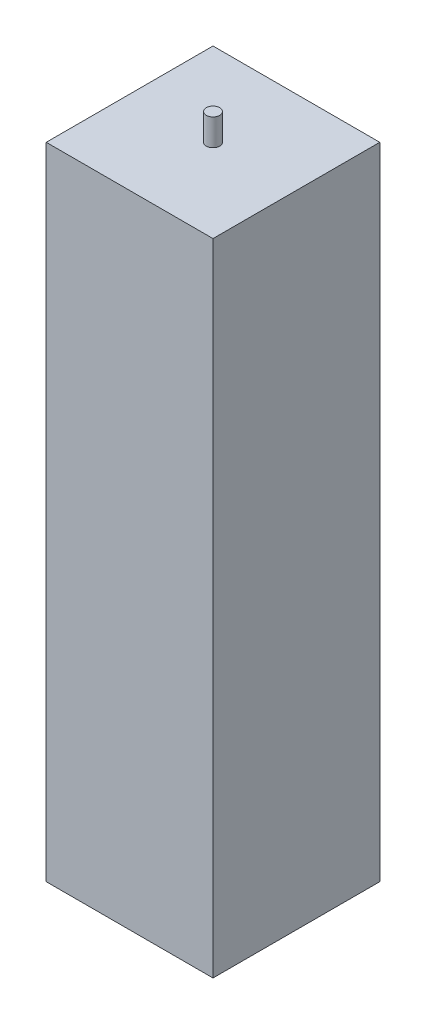
from build123d import *

# Parameters (mm, degrees)
SKETCH_1_W           = 12.5
SKETCH_1_H           = 48
EXTRUDE_1_DEPTH      = 12.5
EXTRUDE_2_DEPTH      = 2
EXTRUDE_2_DEPTH_BACK = 49.5
SKETCH_2_R           = 0.5


with BuildPart() as part:
    # 草图1 → 凸台-拉伸1 (new body)
    with BuildSketch(Plane.XY):
        Rectangle(SKETCH_1_W, SKETCH_1_H)
    extrude(amount=EXTRUDE_1_DEPTH)

    # 草图2 → 凸台-拉伸2 (add, two sides: drawn at the far end of the back side and taken through both)
    with BuildSketch(Plane(origin=(0, 24, 0), x_dir=(1, 0, 0), z_dir=(0, 1, 0)).offset(-EXTRUDE_2_DEPTH_BACK)):
        with Locations((0, -6.25)):
            Circle(SKETCH_2_R)
    extrude(amount=EXTRUDE_2_DEPTH + EXTRUDE_2_DEPTH_BACK)


solid = part.part
